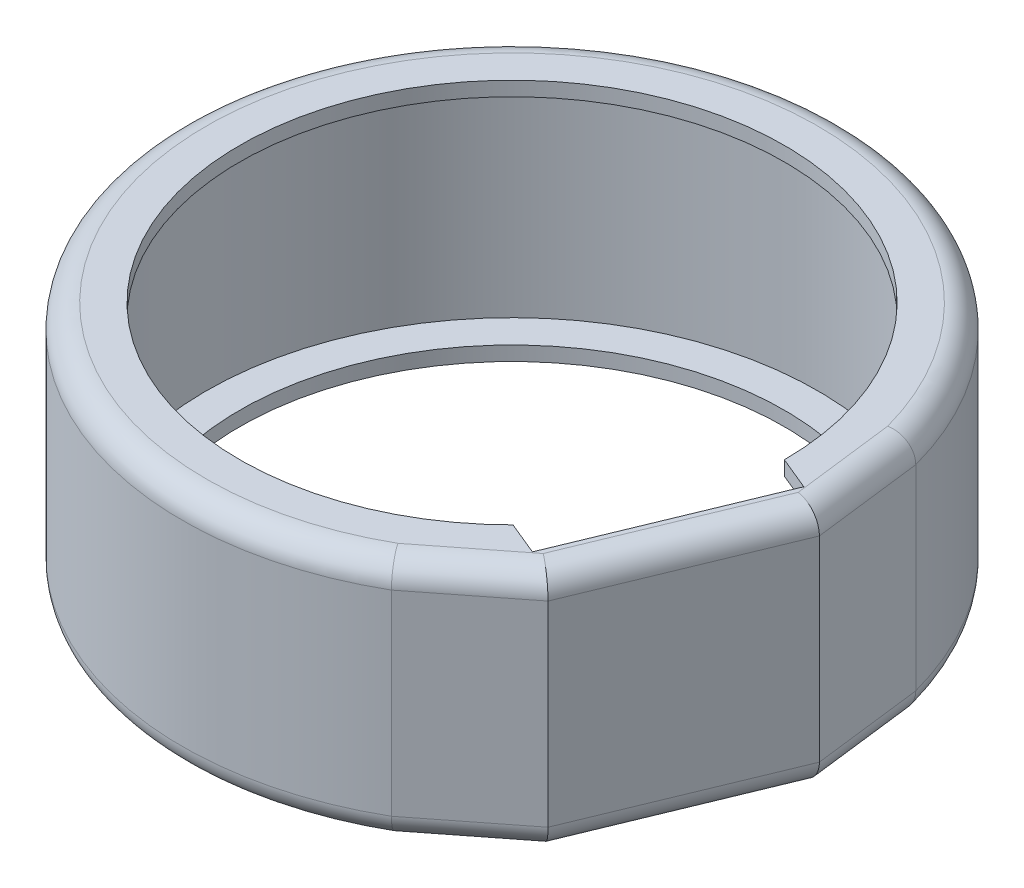
from build123d import *

# Parameters (mm, degrees)
EXTRUDE_1_DEPTH     = 0.6
EXTRUDE_START       = 9
EXTRUDE_3_DEPTH     = 9
EXTRUDE_START_2     = 0.6
EXTRUDE_4_DEPTH     = 0.6
FILLET_1_R          = 1
FILLET_2_R          = 1
SKETCH_7_W          = 8.7
SKETCH_7_H          = 0.6
CUT_EXTRUDE_1_DEPTH = 1.5


with BuildPart() as part:
    # 草图1 → 凸台-拉伸1 (new body)
    with BuildSketch(Plane(origin=(0, 0, 0), x_dir=(1, 0, 0), z_dir=(0, 1, 0))):
        with BuildLine():
            Line((10.575971039, -9.071988551), (13.895707881, -1.030263158))
            Line((13.895707881, -1.030263158), (13.329776403, 3.571702822))
            ThreePointArc((13.329776403, 3.571702822), (-12.749537549, 5.281031367), (6.9, -11.951150572))
            Line((6.9, -11.951150572), (10.575971039, -9.071988551))
        make_face()
        with BuildLine():
            ThreePointArc((8.080263158, -8.041725393), (-10.537433274, 4.35), (11.4, 0))
            Line((11.4, 0), (8.080263158, -8.041725393))
        make_face(mode=Mode.SUBTRACT)
    extrude(amount=EXTRUDE_1_DEPTH)

    # 草图2 → 凸台-拉伸3 (add)
    with BuildSketch(Plane(origin=(0, 0, 0), x_dir=(-1, 0, 0), z_dir=(0, -1, 0)).offset(EXTRUDE_START)):
        with BuildLine():
            Line((-13.895707881, -1.030263158), (-10.575971039, -9.071988551))
            Line((-10.575971039, -9.071988551), (-6.9, -11.951150572))
            ThreePointArc((-6.9, -11.951150572), (12.749537549, 5.281031367), (-13.329776403, 3.571702822))
            Line((-13.329776403, 3.571702822), (-13.895707881, -1.030263158))
        make_face()
        with BuildLine():
            Line((-9.448115748, -8.635572293), (-12.787098442, -0.574554987))
            ThreePointArc((-12.787098442, -0.574554987), (11.825658016, 4.898347934), (-9.448115748, -8.635572293))
        make_face(mode=Mode.SUBTRACT)
    extrude(amount=-EXTRUDE_3_DEPTH)

    # 草图5 → 凸台-拉伸4 (add)
    with BuildSketch(Plane(origin=(0, -9, 0), x_dir=(-1, 0, 0), z_dir=(0, -1, 0)).offset(EXTRUDE_START_2)):
        with BuildLine():
            Line((-13.895707881, -1.030263158), (-10.575971039, -9.071988551))
            Line((-10.575971039, -9.071988551), (-6.9, -11.951150572))
            ThreePointArc((-6.9, -11.951150572), (12.749537549, 5.281031367), (-13.329776403, 3.571702822))
            Line((-13.329776403, 3.571702822), (-13.895707881, -1.030263158))
        make_face()
        with BuildLine():
            ThreePointArc((-11.4, 0), (10.537433274, 4.35), (-8.080263158, -8.041725393))
            Line((-8.080263158, -8.041725393), (-11.4, 0))
        make_face(mode=Mode.SUBTRACT)
    extrude(amount=-EXTRUDE_4_DEPTH)

    # 圆角1
    fillet_1_edges = [part.edges().sort_by_distance(p)[0] for p in [
        (13.612742142, -9.6, -1.270719832),
        (-12.749537549, -9.6, -5.281031367),
        (8.737985519, -9.6, 10.511569562),
        (12.23583946, -9.6, 5.051125854),
    ]]
    fillet(fillet_1_edges, radius=FILLET_1_R)

    # 圆角2
    fillet_2_edges = [part.edges().sort_by_distance(p)[0] for p in [
        (13.612742142, 0.6, -1.270719832),
        (-12.749537549, 0.6, -5.281031367),
        (8.737985519, 0.6, 10.511569562),
        (12.23583946, 0.6, 5.051125854),
    ]]
    fillet(fillet_2_edges, radius=FILLET_2_R)

    # 草图7 → 切除-拉伸1 (cut)
    with BuildSketch(Plane(origin=(9.740131579, 0, 4.020862697), x_dir=(-0.381578947368421, 0, 0.9243362520886043), z_dir=(-0.9243362520886043, 0, -0.381578947368421))):
        with Locations((0, 0.3)):
            Rectangle(SKETCH_7_W, SKETCH_7_H)
    extrude(amount=-CUT_EXTRUDE_1_DEPTH, mode=Mode.SUBTRACT)


solid = part.part
